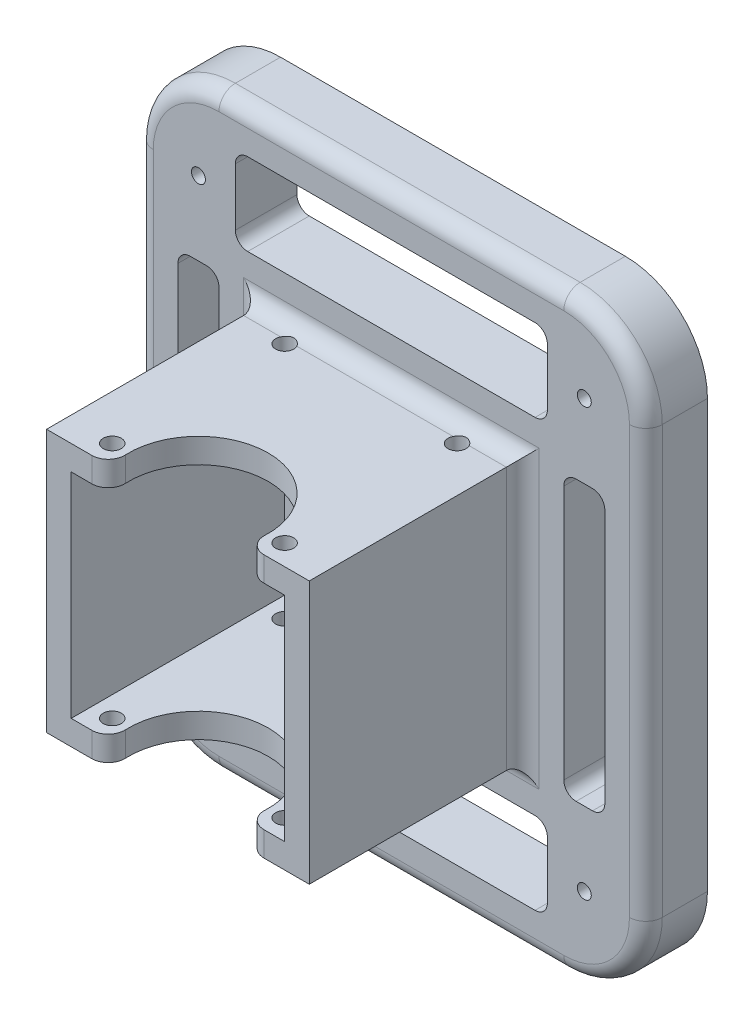
from build123d import *

# Parameters (mm, degrees)
SKETCH_2_W               = 32
SKETCH_2_H               = 32
SKETCH_2_W_2             = 26
SKETCH_2_H_2             = 26
EXTRUDE_1_DEPTH          = 26
SKETCH_3_W               = 62
SKETCH_3_H               = 72
EXTRUDE_2_DEPTH          = 7.5
FILLET_1_R               = 2
FILLET_2_R               = 2
CUT_EXTRUDE_1_DEPTH      = 66.88626564
CUT_EXTRUDE_1_DEPTH_BACK = 66.88626564
SKETCH_5_R               = 1.1
SKETCH_5_R_2             = 8.5
FILLET_3_R               = 2
SKETCH_7_R               = 0.85
CUT_EXTRUDE_2_DEPTH      = 70.189955918
FILLET_4_R               = 10
CUT_EXTRUDE_3_DEPTH      = 66.88626564


with BuildPart() as part:
    # ｽｹｯﾁ2 → ﾎﾞｽ - 押し出し1 (new body)
    with BuildSketch(Plane.XY):
        with Locations((0, 16)):
            Rectangle(SKETCH_2_W, SKETCH_2_H)
        with Locations((0, 16)):
            Rectangle(SKETCH_2_W_2, SKETCH_2_H_2, mode=Mode.SUBTRACT)
    extrude(amount=EXTRUDE_1_DEPTH)

    # ｽｹｯﾁ3 → ﾎﾞｽ - 押し出し2 (add)
    with BuildSketch(Plane(origin=(0, 0, 0), x_dir=(-1, 0, 0), z_dir=(0, 0, -1))):
        with Locations((0, 16)):
            Rectangle(SKETCH_3_W, SKETCH_3_H)
    extrude(amount=EXTRUDE_2_DEPTH)

    # ﾌｨﾚｯﾄ1
    fillet_1_edges = [part.edges().sort_by_distance(p)[0] for p in [
        (0, 32, 0),
        (16, 16, 0),
        (0, 0, 0),
        (-16, 16, 0),
    ]]
    fillet(fillet_1_edges, radius=FILLET_1_R)

    # ﾌｨﾚｯﾄ2
    fillet_2_edges = [part.edges().sort_by_distance(p)[0] for p in [
        (31, 16, 0),
        (0, -20, 0),
        (-31, 16, 0),
        (0, 52, 0),
    ]]
    fillet(fillet_2_edges, radius=FILLET_2_R)

    # ｽｹｯﾁ5 → ｶｯﾄ - 押し出し1 (cut, two sides: drawn at the far end of the back side and taken through both)
    with BuildSketch(Plane.XZ.offset(-CUT_EXTRUDE_1_DEPTH_BACK)):
        with Locations(Location((10.5, 23.5, 0), (0, 0, 270))):
            Circle(SKETCH_5_R)
        with Locations(Location((-10.5, 23.5, 0), (0, 0, 270))):
            Circle(SKETCH_5_R)
        with Locations(Location((-10.5, 2.5, 0), (0, 0, 332.964308211))):
            Circle(SKETCH_5_R)
        with Locations(Location((10.5, 2.5, 0), (0, 0, 332.964308211))):
            Circle(SKETCH_5_R)
        with Locations((0, 23.5)):
            Circle(SKETCH_5_R_2)
    extrude(amount=CUT_EXTRUDE_1_DEPTH + CUT_EXTRUDE_1_DEPTH_BACK, mode=Mode.SUBTRACT)

    # ﾌｨﾚｯﾄ3
    fillet_3_edges = [part.edges().sort_by_distance(p)[0] for p in [
        (8.124038405, 1.5, 26),
        (-8.124038405, 1.5, 26),
        (-8.124038405, 30.5, 26),
        (8.124038405, 30.5, 26),
    ]]
    fillet(fillet_3_edges, radius=FILLET_3_R)

    # ｽｹｯﾁ7 → ｶｯﾄ - 押し出し2 (cut, through all)
    with BuildSketch(Plane(origin=(0, 0, -7.5), x_dir=(-1, 0, 0), z_dir=(0, 0, -1))):
        with Locations((-23.5, -10)):
            Circle(SKETCH_7_R)
        with Locations((-23.5, 42)):
            Circle(SKETCH_7_R)
        with Locations((23.5, 42)):
            Circle(SKETCH_7_R)
        with Locations((23.5, -10)):
            Circle(SKETCH_7_R)
    extrude(amount=-CUT_EXTRUDE_2_DEPTH, mode=Mode.SUBTRACT)

    # ﾌｨﾚｯﾄ4
    # the kernel refuses this fillet: 10 mm, written as the material it takes off along each edge
    with BuildSketch(Plane(origin=(21, -10, 0), x_dir=(0, -1, 0), z_dir=(-1, 0, 0))) as fillet_4_piece_1:
        with BuildLine():
            CenterArc((8, -2), 2, 0, 90)
            Line((10, -2), (10, 0))
            Line((10, 0), (8, 0))
        make_face()
    revolve(axis=Axis((21, -10, 0), (0, 0, 1)), revolution_arc=90, mode=Mode.SUBTRACT)
    with BuildSketch(Plane(origin=(21, 42, 0), x_dir=(1, 0, 0), z_dir=(0, -1, 0))) as fillet_4_piece_2:
        with BuildLine():
            CenterArc((8, -2), 2, 0, 90)
            Line((10, -2), (10, 0))
            Line((10, 0), (8, 0))
        make_face()
    revolve(axis=Axis((21, 42, 0), (0, 0, 1)), revolution_arc=90, mode=Mode.SUBTRACT)
    with BuildSketch(Plane(origin=(-21, -10, 0), x_dir=(-1, 0, 0), z_dir=(0, 1, 0))) as fillet_4_piece_3:
        with BuildLine():
            CenterArc((8, -2), 2, 0, 90)
            Line((10, -2), (10, 0))
            Line((10, 0), (8, 0))
        make_face()
    revolve(axis=Axis((-21, -10, 0), (0, 0, 1)), revolution_arc=90, mode=Mode.SUBTRACT)
    with BuildSketch(Plane(origin=(-21, 42, 0), x_dir=(0, 1, 0), z_dir=(1, 0, 0))) as fillet_4_piece_4:
        with BuildLine():
            CenterArc((8, -2), 2, 0, 90)
            Line((10, -2), (10, 0))
            Line((10, 0), (8, 0))
        make_face()
    revolve(axis=Axis((-21, 42, 0), (0, 0, 1)), revolution_arc=90, mode=Mode.SUBTRACT)
    with BuildSketch(Plane(origin=(31, 52, 0), x_dir=(0, -1, 0), z_dir=(0, 0, -1)), Plane(origin=(-31, 52, 0), x_dir=(1, 0, 0), z_dir=(0, 0, -1))) as fillet_4_piece_5:
        with BuildLine():
            CenterArc((FILLET_4_R, FILLET_4_R), FILLET_4_R, 180, 90)
            Line((0, FILLET_4_R), (0, 0))
            Line((0, 0), (FILLET_4_R, 0))
        make_face()
    extrude(amount=32.5, mode=Mode.SUBTRACT)
    with BuildSketch(Plane(origin=(31, -20, 0), x_dir=(0, 1, 0), z_dir=(0, 0, -1)), Plane(origin=(-31, -20, 0), x_dir=(1, 0, 0), z_dir=(0, 0, -1))) as fillet_4_piece_6:
        with BuildLine():
            CenterArc((FILLET_4_R, -FILLET_4_R), FILLET_4_R, 90, 90)
            Line((0, -FILLET_4_R), (0, 0))
            Line((0, 0), (FILLET_4_R, 0))
        make_face()
    extrude(amount=32.5, mode=Mode.SUBTRACT)

    # ｽｹｯﾁ8 → ｶｯﾄ - 押し出し3 (cut, through all)
    with BuildSketch(Plane.XY):
        with BuildLine():
            Line((-17.5, 47), (17.5, 47))
            ThreePointArc((17.5, 47), (18.560660172, 46.560660172), (19, 45.5))
            Line((19, 45.5), (19, 38.5))
            ThreePointArc((19, 38.5), (18.560660172, 37.439339828), (17.5, 37))
            Line((17.5, 37), (-17.5, 37))
            ThreePointArc((-17.5, 37), (-18.560660172, 37.439339828), (-19, 38.5))
            Line((-19, 38.5), (-19, 45.5))
            ThreePointArc((-19, 45.5), (-18.560660172, 46.560660172), (-17.5, 47))
        make_face()
        with BuildLine():
            Line((22.5, 33), (24.5, 33))
            ThreePointArc((24.5, 33), (25.560660172, 32.560660172), (26, 31.5))
            Line((26, 31.5), (26, 0.5))
            ThreePointArc((26, 0.5), (25.560660172, -0.560660172), (24.5, -1))
            Line((24.5, -1), (22.5, -1))
            ThreePointArc((22.5, -1), (21.439339828, -0.560660172), (21, 0.5))
            Line((21, 0.5), (21, 31.5))
            ThreePointArc((21, 31.5), (21.439339828, 32.560660172), (22.5, 33))
        make_face()
        with BuildLine():
            Line((-24.5, 33), (-22.5, 33))
            ThreePointArc((-22.5, 33), (-21.439339828, 32.560660172), (-21, 31.5))
            Line((-21, 31.5), (-21, 0.5))
            ThreePointArc((-21, 0.5), (-21.439339828, -0.560660172), (-22.5, -1))
            Line((-22.5, -1), (-24.5, -1))
            ThreePointArc((-24.5, -1), (-25.560660172, -0.560660172), (-26, 0.5))
            Line((-26, 0.5), (-26, 31.5))
            ThreePointArc((-26, 31.5), (-25.560660172, 32.560660172), (-24.5, 33))
        make_face()
        with BuildLine():
            Line((-17.5, -5), (17.5, -5))
            ThreePointArc((17.5, -5), (18.560660172, -5.439339828), (19, -6.5))
            Line((19, -6.5), (19, -13.5))
            ThreePointArc((19, -13.5), (18.560660172, -14.560660172), (17.5, -15))
            Line((17.5, -15), (-17.5, -15))
            ThreePointArc((-17.5, -15), (-18.560660172, -14.560660172), (-19, -13.5))
            Line((-19, -13.5), (-19, -6.5))
            ThreePointArc((-19, -6.5), (-18.560660172, -5.439339828), (-17.5, -5))
        make_face()
    extrude(amount=-CUT_EXTRUDE_3_DEPTH, mode=Mode.SUBTRACT)


solid = part.part
